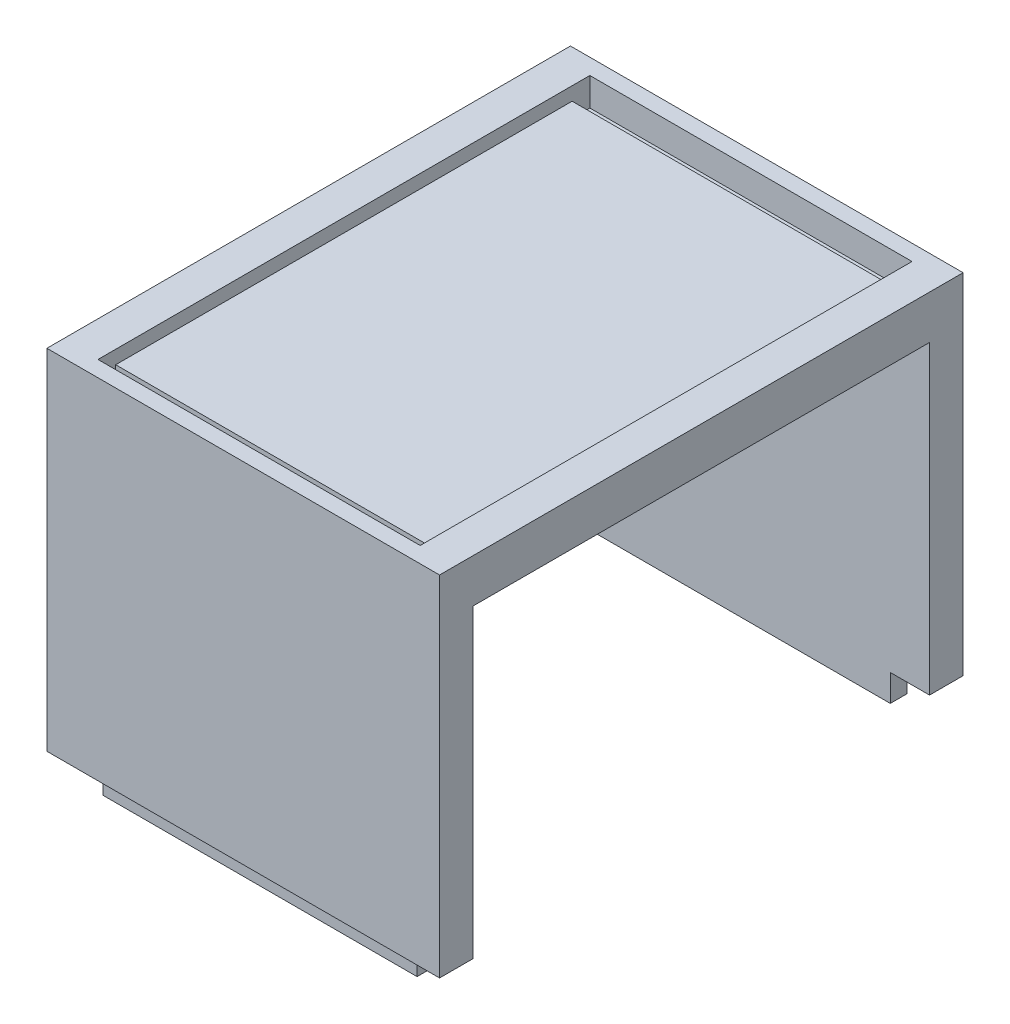
from build123d import *

# Parameters (mm, degrees)
SKETCH1_W           = 29.25
SKETCH1_H           = 39
BOSS_EXTRUDE1_DEPTH = 3.25
SKETCH2_W           = 24
SKETCH2_H           = 34
CUT_EXTRUDE1_DEPTH  = 1
SKETCH3_W           = 24
SKETCH3_H           = 1.32
CUT_EXTRUDE2_DEPTH  = 2.1
SKETCH4_W           = 29.25
SKETCH4_H           = 22.75
BOSS_EXTRUDE2_DEPTH = 2.5
SKETCH6_W           = 23.4
SKETCH6_H           = 1.25
BOSS_EXTRUDE3_DEPTH = 2


with BuildPart() as part:
    # Sketch1 → Boss-Extrude1 (new body)
    with BuildSketch(Plane(origin=(0, 0, 0), x_dir=(1, 0, 0), z_dir=(0, 1, 0))):
        Rectangle(SKETCH1_W, SKETCH1_H)
    extrude(amount=BOSS_EXTRUDE1_DEPTH)

    # Sketch2 → Cut-Extrude1 (cut)
    with BuildSketch(Plane(origin=(0, 3.25, 0), x_dir=(1, 0, 0), z_dir=(0, 1, 0))):
        Rectangle(SKETCH2_W, SKETCH2_H)
    extrude(amount=-CUT_EXTRUDE1_DEPTH, mode=Mode.SUBTRACT)

    # Sketch3 → Cut-Extrude2 (cut)
    with BuildSketch(Plane(origin=(0, 3.25, 0), x_dir=(1, 0, 0), z_dir=(0, 1, 0))):
        with Locations((0, -17.66)):
            Rectangle(SKETCH3_W, SKETCH3_H)
    cut_extrude2 = extrude(amount=-CUT_EXTRUDE2_DEPTH, mode=Mode.SUBTRACT)

    # Mirror1: Cut-Extrude2 across plane
    add(cut_extrude2.mirror(Plane.XY), mode=Mode.SUBTRACT)

    # Sketch4 → Boss-Extrude2 (add)
    with BuildSketch(Plane.XY.offset(19.5)):
        with Locations((0, -11.375)):
            Rectangle(SKETCH4_W, SKETCH4_H)
    boss_extrude2 = extrude(amount=-BOSS_EXTRUDE2_DEPTH)

    # Sketch6 → Boss-Extrude3 (add)
    with BuildSketch(Plane.XZ.offset(22.75)):
        with Locations((0, 17.625)):
            Rectangle(SKETCH6_W, SKETCH6_H)
    boss_extrude3 = extrude(amount=BOSS_EXTRUDE3_DEPTH)

    # Mirror2: Boss-Extrude2, Boss-Extrude3 across plane
    add(boss_extrude2.mirror(Plane.XY))
    add(boss_extrude3.mirror(Plane.XY))


solid = part.part
